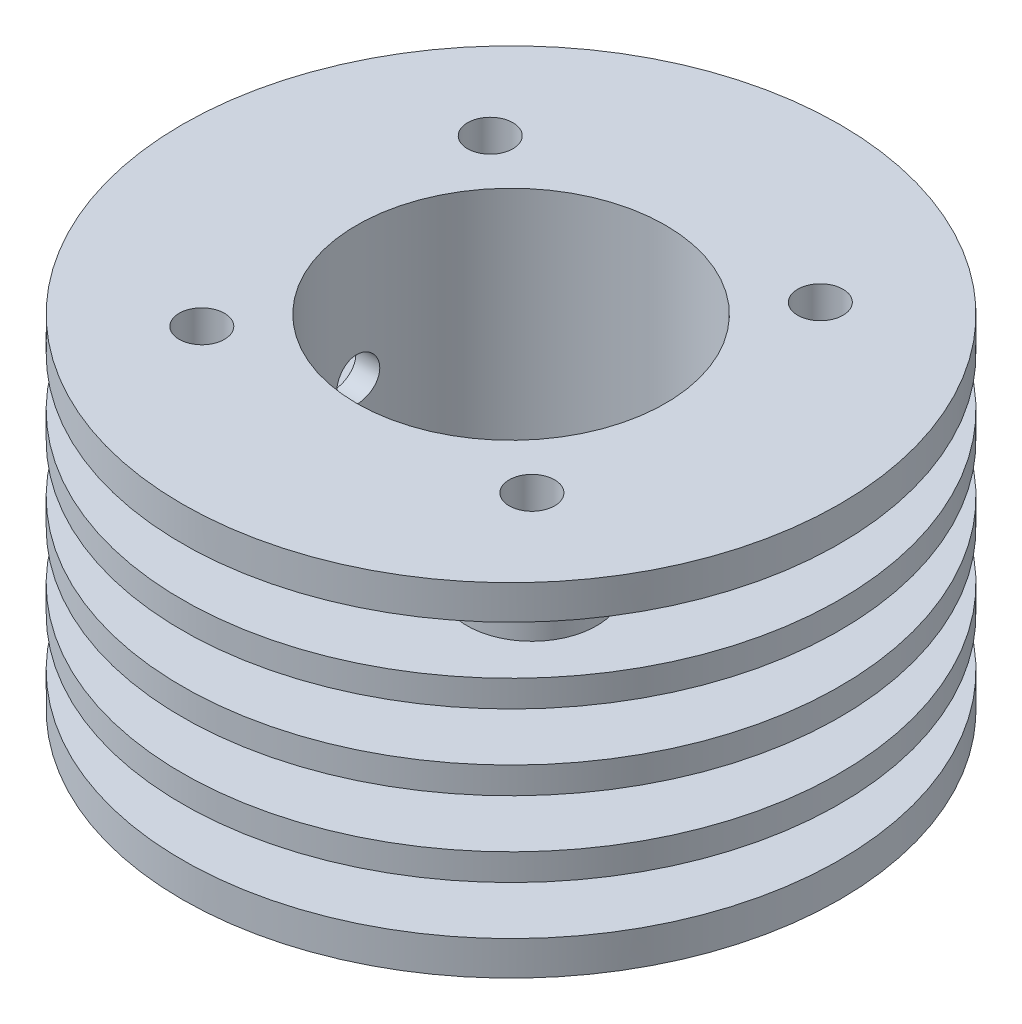
from build123d import *

# Parameters (mm, degrees)
SKETCH1_R                        = 30.48
SKETCH1_R_2                      = 14.3129
BOSS_EXTRUDE1_DEPTH              = 31.75
SKETCH2_W                        = 13.97
SKETCH2_H                        = 4.5
BOSS_EXTRUDE2_START              = -7.675
BOSS_EXTRUDE2_OUTLINE_R          = 16.51
BOSS_EXTRUDE2_DEPTH              = 4.5
CUT_EXTRUDE2_REACH               = 55.536
CUT_EXTRUDE2_END_RADIUS          = 16.51
SKETCH8_R                        = 2
CUT_EXTRUDE3_REACH               = 55.536
CUT_EXTRUDE3_END_RADIUS          = 16.51
SKETCH9_R                        = 2
SKETCH10_R                       = 1
CUT_EXTRUDE4_DEPTH               = 10.141666667
TAP_DRILL_FOR_M5X0_8_TAP1_REACH  = 72.9
TAP_DRILL_FOR_M5X0_8_TAP1_BORE_R = 2.1


with BuildPart() as part:
    # Sketch1 → Boss-Extrude1 (new body)
    with BuildSketch(Plane(origin=(0, 0, 0), x_dir=(1, 0, 0), z_dir=(0, 1, 0))):
        with Locations(Location((0, 0, 0), (0, 0, 270))):
            Circle(SKETCH1_R)
        with Locations(Location((0, 0, 0), (0, 0, 270))):
            Circle(SKETCH1_R_2, mode=Mode.SUBTRACT)
    extrude(amount=BOSS_EXTRUDE1_DEPTH)

    # Sketch2 → Cut-Revolve2 (revolve, cut)
    with BuildSketch(Plane.XY, mode=Mode.PRIVATE) as cut_revolve2_sk:
        with Locations((23.495, 26.325)):
            Rectangle(SKETCH2_W, SKETCH2_H)
        with Locations((23.495, 12.391666667)):
            Rectangle(SKETCH2_W, SKETCH2_H)
        with Locations((23.495, 5.425)):
            Rectangle(SKETCH2_W, SKETCH2_H)
        with Locations((23.495, 19.358333333)):
            Rectangle(SKETCH2_W, SKETCH2_H)
    revolve(cut_revolve2_sk.sketch.rotate(Axis((0, 0, 0), (0, 1, 0)), 90), axis=Axis((0, 0, 0), (0, 1, 0)), mode=Mode.SUBTRACT)

    # Boss-Extrude2: read off the stored shape, not the designer's step
    # Boss-Extrude2 outline → Boss-Extrude2 (add)
    with BuildSketch(Plane(origin=(0, 31.75, 0), x_dir=(1, 0, 0), z_dir=(0, 1, 0)).offset(BOSS_EXTRUDE2_START)):
        with BuildLine():
            ThreePointArc((-20.446529483, 10.269067687), (-16.857865235, -1.135728529), (-18.884341927, -12.918821503))
            ThreePointArc((-18.884341927, -12.918821503), (-17.322622903, -19.825310342), (-10.269067687, -20.446529483))
            ThreePointArc((-10.269067687, -20.446529483), (1.135728529, -16.857865235), (12.918821503, -18.884341927))
            ThreePointArc((12.918821503, -18.884341927), (19.825310342, -17.322622903), (20.446529483, -10.269067687))
            ThreePointArc((20.446529483, -10.269067687), (16.857865235, 1.135728529), (18.884341927, 12.918821503))
            ThreePointArc((18.884341927, 12.918821503), (17.322622903, 19.825310342), (10.269067687, 20.446529483))
            ThreePointArc((10.269067687, 20.446529483), (-1.135728529, 16.857865235), (-12.918821503, 18.884341927))
            ThreePointArc((-12.918821503, 18.884341927), (-19.825310342, 17.322622903), (-20.446529483, 10.269067687))
        make_face()
        Circle(BOSS_EXTRUDE2_OUTLINE_R, mode=Mode.SUBTRACT)
    extrude(amount=BOSS_EXTRUDE2_DEPTH)

    # Cut-Extrude2: up to this cylinder (the profile starts inside it)
    cut_extrude2_end = Plane(origin=(0, 19.358333, 0), z_dir=(0, -1, 0)) * Cylinder(CUT_EXTRUDE2_END_RADIUS, 145.092, mode=Mode.PRIVATE)
    # Sketch8 → Cut-Extrude2 (cut, up to the surface)
    with BuildSketch(Plane.XY, mode=Mode.PRIVATE) as cut_extrude2_sk1:
        with Locations(Location((0, 19.358333333, 0), (0, 0, 180))):
            Circle(SKETCH8_R)
    cut_extrude2_tool1 = extrude(cut_extrude2_sk1.sketch, amount=CUT_EXTRUDE2_REACH, mode=Mode.PRIVATE) & cut_extrude2_end
    add(cut_extrude2_tool1.solids().sort_by_distance((0, 19.358333, 0))[0], mode=Mode.SUBTRACT)

    # Cut-Extrude3: up to this cylinder (the profile starts inside it)
    cut_extrude3_end = Plane(origin=(0, 19.358333, 0), z_dir=(0, -1, 0)) * Cylinder(CUT_EXTRUDE3_END_RADIUS, 145.092, mode=Mode.PRIVATE)
    # Sketch9 → Cut-Extrude3 (cut, up to the surface)
    with BuildSketch(Plane(origin=(0, 0, 0), x_dir=(0, 0, -1), z_dir=(1, 0, 0)), mode=Mode.PRIVATE) as cut_extrude3_sk1:
        with Locations((0, 19.358333333)):
            Circle(SKETCH9_R)
    cut_extrude3_tool1 = extrude(cut_extrude3_sk1.sketch, amount=-CUT_EXTRUDE3_REACH, mode=Mode.PRIVATE) & cut_extrude3_end
    add(cut_extrude3_tool1.solids().sort_by_distance((0, 19.358333, 0))[0], mode=Mode.SUBTRACT)

    # Sketch10 → Cut-Extrude4 (cut)
    with BuildSketch(Plane(origin=(0, 31.75, 0), x_dir=(1, 0, 0), z_dir=(0, 1, 0))):
        with Locations(Location((15.301734948, -13.370090036, 0), (0, 0, 270))):
            Circle(SKETCH10_R)
        with Locations(Location((13.370090036, 15.301734948, 0), (0, 0, 270))):
            Circle(SKETCH10_R)
        with Locations(Location((-15.301734948, 13.370090036, 0), (0, 0, 270))):
            Circle(SKETCH10_R)
        with Locations(Location((-13.370090036, -15.301734948, 0), (0, 0, 270))):
            Circle(SKETCH10_R)
    extrude(amount=-CUT_EXTRUDE4_DEPTH, mode=Mode.SUBTRACT)

    # Tap Drill for M5x0.8 Tap1 bore (on position points) → Tap Drill for M5x0.8 Tap1 (cut, up to next)
    with BuildSketch(Plane(origin=(15.301734948, 31.75, 13.370090036), x_dir=(0, 0, 1), z_dir=(0, 1, 0)), mode=Mode.PRIVATE) as tap_drill_for_m5x0_8_tap1_sk1:
        Circle(TAP_DRILL_FOR_M5X0_8_TAP1_BORE_R)
    tap_drill_for_m5x0_8_tap1_tool1 = extrude(tap_drill_for_m5x0_8_tap1_sk1.sketch, amount=-TAP_DRILL_FOR_M5X0_8_TAP1_REACH, mode=Mode.PRIVATE) & part.part
    # Tap Drill for M5x0.8 Tap1 bore (on position points) → Tap Drill for M5x0.8 Tap1 (cut, up to next)
    with BuildSketch(Plane(origin=(15.301734948, 31.75, 13.370090036), x_dir=(0, 0, 1), z_dir=(0, 1, 0)), mode=Mode.PRIVATE) as tap_drill_for_m5x0_8_tap1_sk2:
        with Locations((1.931644912, -28.671824984)):
            Circle(TAP_DRILL_FOR_M5X0_8_TAP1_BORE_R)
    tap_drill_for_m5x0_8_tap1_tool2 = extrude(tap_drill_for_m5x0_8_tap1_sk2.sketch, amount=-TAP_DRILL_FOR_M5X0_8_TAP1_REACH, mode=Mode.PRIVATE) & part.part
    # Tap Drill for M5x0.8 Tap1 bore (on position points) → Tap Drill for M5x0.8 Tap1 (cut, up to next)
    with BuildSketch(Plane(origin=(15.301734948, 31.75, 13.370090036), x_dir=(0, 0, 1), z_dir=(0, 1, 0)), mode=Mode.PRIVATE) as tap_drill_for_m5x0_8_tap1_sk3:
        with Locations((-26.740180072, -30.603469896)):
            Circle(TAP_DRILL_FOR_M5X0_8_TAP1_BORE_R)
    tap_drill_for_m5x0_8_tap1_tool3 = extrude(tap_drill_for_m5x0_8_tap1_sk3.sketch, amount=-TAP_DRILL_FOR_M5X0_8_TAP1_REACH, mode=Mode.PRIVATE) & part.part
    # Tap Drill for M5x0.8 Tap1 bore (on position points) → Tap Drill for M5x0.8 Tap1 (cut, up to next)
    with BuildSketch(Plane(origin=(15.301734948, 31.75, 13.370090036), x_dir=(0, 0, 1), z_dir=(0, 1, 0)), mode=Mode.PRIVATE) as tap_drill_for_m5x0_8_tap1_sk4:
        with Locations((-28.671824984, -1.931644912)):
            Circle(TAP_DRILL_FOR_M5X0_8_TAP1_BORE_R)
    tap_drill_for_m5x0_8_tap1_tool4 = extrude(tap_drill_for_m5x0_8_tap1_sk4.sketch, amount=-TAP_DRILL_FOR_M5X0_8_TAP1_REACH, mode=Mode.PRIVATE) & part.part
    add(tap_drill_for_m5x0_8_tap1_tool1.solids().sort_by_distance((15.301735, 31.75, 13.37009))[0], mode=Mode.SUBTRACT)
    add(tap_drill_for_m5x0_8_tap1_tool2.solids().sort_by_distance((-13.37009, 31.75, 15.301735))[0], mode=Mode.SUBTRACT)
    add(tap_drill_for_m5x0_8_tap1_tool3.solids().sort_by_distance((-15.301735, 31.75, -13.37009))[0], mode=Mode.SUBTRACT)
    add(tap_drill_for_m5x0_8_tap1_tool4.solids().sort_by_distance((13.37009, 31.75, -15.301735))[0], mode=Mode.SUBTRACT)


solid = part.part
